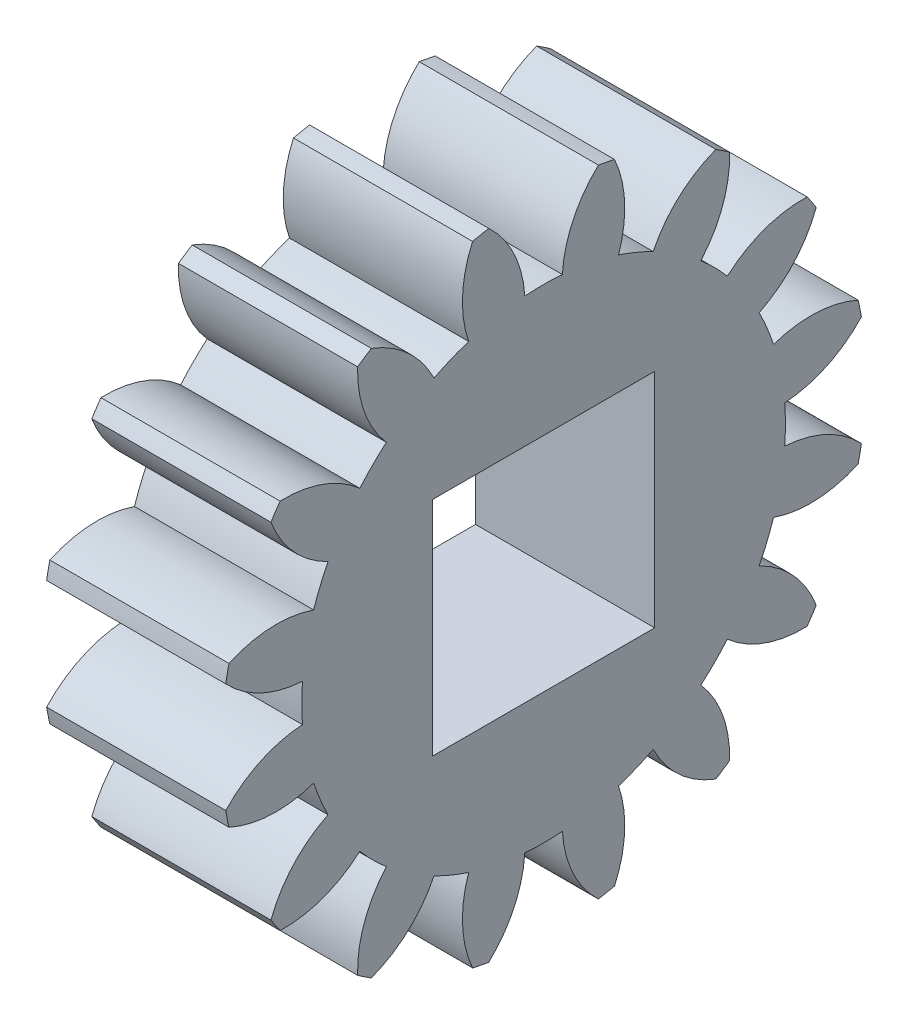
from build123d import *

# Parameters (mm, degrees)
BASPROSKE_W        = 5
BASPROSKE_H        = 9
TOOTHCUT_DEPTH     = 14.674794331
TEETHCUTS_COUNT    = 16
TEETHCUTS_ANGLE    = 337.5
BORSKE_R           = 3
BORE_DEPTH         = 50.0000508
SKETCH1_W          = 6.2
SKETCH1_H          = 6.2
CUT_EXTRUDE1_DEPTH = 10


with BuildPart() as part:
    # BasProSke → Base-Revolve (revolve)
    with BuildSketch(Plane(origin=(0, 0, 0), x_dir=(1, 0, 0), z_dir=(0, 1, 0))):
        with Locations((2.5, 4.5)):
            Rectangle(BASPROSKE_W, BASPROSKE_H)
    revolve(axis=Axis((-10, 0, 0), (1, 0, 0)))

    # TooCutSke → ToothCut (cut, through all)
    with BuildSketch(Plane(origin=(0, 0, 0), x_dir=(0, 0, -1), z_dir=(1, 0, 0))):
        with BuildLine():
            ThreePointArc((0.523792937, 6.728643397), (0, 6.749), (-0.523792937, 6.728643397))
            ThreePointArc((-0.523792937, 6.728643397), (-0.828704482, 7.90962059), (-1.553355277, 8.890721711))
            ThreePointArc((-1.553355277, 8.890721711), (0, 9.0254), (1.553355277, 8.890721711))
            ThreePointArc((1.553355277, 8.890721711), (0.828704482, 7.90962059), (0.523792937, 6.728643397))
        make_face()
    toothcut = extrude(amount=TOOTHCUT_DEPTH, mode=Mode.SUBTRACT)

    # TeethCuts: ToothCut ×16 about axis
    teethcuts_axis = Axis((-10, 0, 0), (1, 0, 0))
    for i in range(1, TEETHCUTS_COUNT):
        add(toothcut.rotate(teethcuts_axis, i * TEETHCUTS_ANGLE / (TEETHCUTS_COUNT - 1)), mode=Mode.SUBTRACT)

    # BorSke → Bore (cut, symmetric)
    with BuildSketch(Plane(origin=(0, 0, 0), x_dir=(0, 0, -1), z_dir=(1, 0, 0))):
        Circle(BORSKE_R)
    extrude(amount=BORE_DEPTH, both=True, mode=Mode.SUBTRACT)

    # Sketch1 → Cut-Extrude1 (cut)
    with BuildSketch(Plane(origin=(5, 0, 0), x_dir=(0, 0, -1), z_dir=(1, 0, 0))):
        Rectangle(SKETCH1_W, SKETCH1_H)
    extrude(amount=-CUT_EXTRUDE1_DEPTH, mode=Mode.SUBTRACT)


solid = part.part
